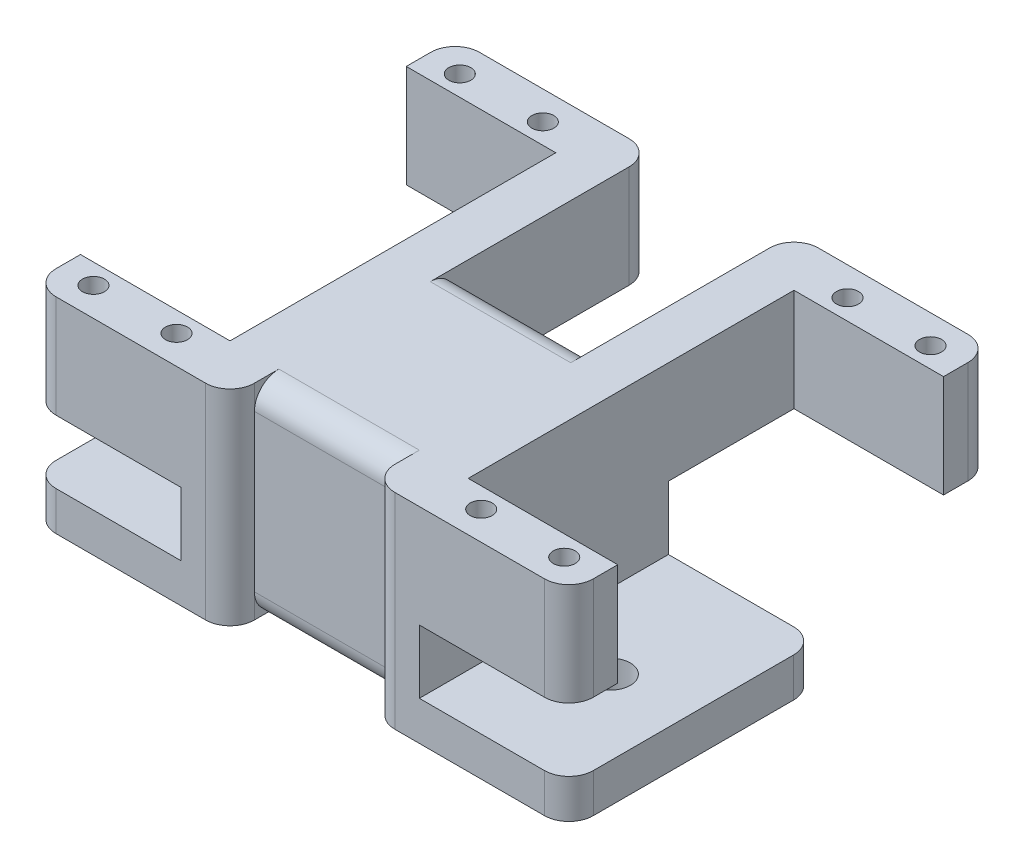
from build123d import *

# Parameters (mm, degrees)
BOSS_EXTRUDE1_DEPTH      = 8
BOSS_EXTRUDE2_DEPTH      = 13
BOSS_EXTRUDE3_DEPTH      = 21
CUT_EXTRUDE1_DEPTH       = 14.382189634
CUT_EXTRUDE2_START       = 21
CUT_EXTRUDE2_OUTLINE_R   = 2.25
CUT_EXTRUDE2_DEPTH       = 21
CUT_EXTRUDE2_2_OUTLINE_R = 4
CUT_EXTRUDE2_2_DEPTH     = 8
SKETCH6_W                = 3.704166667
SKETCH6_H                = 0.664850427
CUT_EXTRUDE3_DEPTH       = 0.5


# Read off the part's stored shape, not the designer's step: Cut-Extrude2
with BuildPart() as part:
    # Sketch1 → Boss-Extrude1 (new body)
    with BuildSketch(Plane(origin=(0, 0, 0), x_dir=(1, 0, 0), z_dir=(0, 1, 0))):
        with BuildLine():
            Line((-26.81143191, 27.740848342), (-57.429242277, 27.740848342))
            ThreePointArc((-57.429242277, 27.740848342), (-60.964776183, 26.276382248), (-62.429242277, 22.740848342))
            Line((-62.429242277, 22.740848342), (-62.429242277, -18.259151658))
            ThreePointArc((-62.429242277, -18.259151658), (-60.964776183, -21.794685564), (-57.429242277, -23.259151658))
            Line((-57.429242277, -23.259151658), (-26.81143191, -23.259151658))
            ThreePointArc((-26.81143191, -23.259151658), (-23.275898004, -21.794685564), (-21.81143191, -18.259151658))
            Line((-21.81143191, -18.259151658), (-7.429242277, -18.259151658))
            Line((-7.429242277, -18.259151658), (-7.429242277, 22.740848342))
            Line((-7.429242277, 22.740848342), (-21.81143191, 22.740848342))
            ThreePointArc((-21.81143191, 22.740848342), (-23.275898004, 26.276382248), (-26.81143191, 27.740848342))
        make_face()
    extrude(amount=BOSS_EXTRUDE1_DEPTH)

    # Sketch2 → Boss-Extrude2 (add)
    with BuildSketch(Plane(origin=(0, 8, 0), x_dir=(1, 0, 0), z_dir=(0, 1, 0))):
        with BuildLine():
            Line((-21.81143191, -18.259151658), (-7.429242277, -18.259151658))
            Line((-7.429242277, -18.259151658), (-7.429242277, 22.740848342))
            Line((-7.429242277, 22.740848342), (-21.81143191, 22.740848342))
            ThreePointArc((-21.81143191, 22.740848342), (-23.275898004, 26.276382248), (-26.81143191, 27.740848342))
            Line((-26.81143191, 27.740848342), (-31.81143191, 27.740848342))
            Line((-31.81143191, 27.740848342), (-31.81143191, -23.259151658))
            Line((-31.81143191, -23.259151658), (-26.81143191, -23.259151658))
            ThreePointArc((-26.81143191, -23.259151658), (-23.275898004, -21.794685564), (-21.81143191, -18.259151658))
        make_face()
    extrude(amount=BOSS_EXTRUDE2_DEPTH)

    # Sketch3 → Boss-Extrude3 (add)
    with BuildSketch(Plane(origin=(0, 21, 0), x_dir=(1, 0, 0), z_dir=(0, 1, 0))):
        with BuildLine():
            Line((-57.429242277, -23.259151658), (-26.81143191, -23.259151658))
            ThreePointArc((-26.81143191, -23.259151658), (-23.275898004, -21.794685564), (-21.81143191, -18.259151658))
            Line((-21.81143191, -18.259151658), (-7.429242277, -18.259151658))
            Line((-7.429242277, -18.259151658), (-7.429242277, 22.740848342))
            Line((-7.429242277, 22.740848342), (-21.81143191, 22.740848342))
            Line((-21.81143191, 22.740848342), (-21.81143191, 58.440848342))
            ThreePointArc((-21.81143191, 58.440848342), (-23.275898004, 61.976382248), (-26.81143191, 63.440848342))
            Line((-26.81143191, 63.440848342), (-57.429242277, 63.440848342))
            ThreePointArc((-57.429242277, 63.440848342), (-60.964776183, 61.976382248), (-62.429242277, 58.440848342))
            Line((-62.429242277, 58.440848342), (-62.429242277, 53.440848342))
            Line((-62.429242277, 53.440848342), (-31.81143191, 53.440848342))
            Line((-31.81143191, 53.440848342), (-31.81143191, -13.259151658))
            Line((-31.81143191, -13.259151658), (-62.429242277, -13.259151658))
            Line((-62.429242277, -13.259151658), (-62.429242277, -18.259151658))
            ThreePointArc((-62.429242277, -18.259151658), (-60.964776183, -21.794685564), (-57.429242277, -23.259151658))
        make_face()
    extrude(amount=BOSS_EXTRUDE3_DEPTH)

    # Sketch4 → Cut-Extrude1 (cut)
    with BuildSketch(Plane(origin=(-7.429242277, 0, 0), x_dir=(0, 0, -1), z_dir=(1, 0, 0))):
        with BuildLine():
            Line((-18.259151658, 42), (-18.259151658, 37))
            ThreePointArc((-18.259151658, 37), (-16.794685564, 40.535533906), (-13.259151658, 42))
            Line((-13.259151658, 42), (-18.259151658, 42))
        make_face()
        with BuildLine():
            ThreePointArc((17.740848342, 42), (21.276382248, 40.535533906), (22.740848342, 37))
            Line((22.740848342, 37), (22.740848342, 42))
            Line((22.740848342, 42), (17.740848342, 42))
        make_face()
        with BuildLine():
            ThreePointArc((22.740848342, 5), (21.276382248, 1.464466094), (17.740848342, 0))
            Line((17.740848342, 0), (22.740848342, 0))
            Line((22.740848342, 0), (22.740848342, 5))
        make_face()
        with BuildLine():
            Line((-18.259151658, 5), (-18.259151658, 0))
            Line((-18.259151658, 0), (-13.259151658, 0))
            ThreePointArc((-13.259151658, 0), (-16.794685564, 1.464466094), (-18.259151658, 5))
        make_face()
    extrude(amount=-CUT_EXTRUDE1_DEPTH, mode=Mode.SUBTRACT)

    # Cut-Extrude2 outline → Cut-Extrude2 (cut)
    with BuildSketch(Plane(origin=(0, 0, 0), x_dir=(1, 0, 0), z_dir=(0, 1, 0)).offset(CUT_EXTRUDE2_START)):
        with Locations((-38.620337094, -17.409151658)):
            Circle(CUT_EXTRUDE2_OUTLINE_R)
        with Locations((-55.620337094, -17.409151658)):
            Circle(CUT_EXTRUDE2_OUTLINE_R)
        with Locations((-55.620337094, 57.590848342)):
            Circle(CUT_EXTRUDE2_OUTLINE_R)
        with Locations((-38.620337094, 57.590848342)):
            Circle(CUT_EXTRUDE2_OUTLINE_R)
    extrude(amount=CUT_EXTRUDE2_DEPTH, mode=Mode.SUBTRACT)

    # Cut-Extrude2 2 outline → Cut-Extrude2 2 (cut)
    with BuildSketch(Plane(origin=(0, 0, 0), x_dir=(1, 0, 0), z_dir=(0, 1, 0))):
        with Locations((-47.121628292, 0.618575522)):
            Circle(CUT_EXTRUDE2_2_OUTLINE_R)
    extrude(amount=CUT_EXTRUDE2_2_DEPTH, mode=Mode.SUBTRACT)

    # Mirror1: part across plane


with BuildPart() as part_1:
    add(part.part)
    add(part.part.mirror(Plane(origin=(-7.429242277, 8, -22.740848342), x_dir=(0, 0, 1), z_dir=(-1, 0, 0))))

    # Sketch6 → Cut-Extrude3 (cut)
    # profile 1 of 7: a face of its own
    with BuildSketch(Plane.XZ):
        with BuildLine():
            add(Edge.make_bspline(
                [(-3.630096978, 6.670225042), (-3.631763453, 6.605823043), (-3.635053452, 6.47867891), (-3.662508867, 6.291704811), (-3.707167108, 6.111485598), (-3.769591277, 5.938059459), (-3.850168987, 5.77166195), (-3.949231991, 5.612719643), (-4.065238137, 5.460206444), (-4.197974341, 5.316937979), (-4.343022727, 5.185522245), (-4.497670692, 5.069977381), (-4.660192762, 4.972161462), (-4.830444829, 4.892169997), (-5.008781458, 4.830229061), (-5.195109529, 4.786992735), (-5.38908513, 4.759150358), (-5.521163241, 4.755952955), (-5.588289252, 4.75432794)],
                knots=[0, 0, 0, 0, 1.014244935, 2.002349224, 2.970143685, 3.935298574, 4.900830986, 5.877310296, 6.881148894, 7.915268703, 8.949887647, 9.960720774, 10.951801935, 11.933244874, 12.919141415, 13.920101769, 14.942934067, 16, 16, 16, 16], degree=3))
            add(Edge.make_bspline(
                [(-5.588289252, 4.75432794), (-5.654658982, 4.7560585), (-5.785442664, 4.759468624), (-5.977629635, 4.785858049), (-6.161965663, 4.829818413), (-6.33855639, 4.890732759), (-6.507440148, 4.969184205), (-6.668440563, 5.065273495), (-6.820943896, 5.179877543), (-6.964575945, 5.309220317), (-7.094912793, 5.451618473), (-7.210084839, 5.602497427), (-7.30697826, 5.761557134), (-7.387003565, 5.927673441), (-7.448871312, 6.101572669), (-7.49256508, 6.282860052), (-7.519108508, 6.471566302), (-7.522499637, 6.599894141), (-7.524220909, 6.665030898)],
                knots=[0, 0, 0, 0, 1.051446269, 2.071908608, 3.067230498, 4.050151293, 5.026863609, 6.012936299, 7.01551645, 8.045060801, 9.071444569, 10.070117656, 11.048150216, 12.017576978, 12.987003741, 13.967083865, 14.968130643, 16, 16, 16, 16], degree=3))
            add(Edge.make_bspline(
                [(-7.524220909, 6.665030898), (-7.522677039, 6.733156276), (-7.519643546, 6.86701333), (-7.490796407, 7.062913729), (-7.447342538, 7.250603238), (-7.38248997, 7.428505157), (-7.301418807, 7.598431266), (-7.20157481, 7.759133068), (-7.083122977, 7.910556556), (-6.949096905, 8.051833139), (-6.802442986, 8.179830067), (-6.647516126, 8.292812462), (-6.48549983, 8.388115618), (-6.31631827, 8.465743023), (-6.141022868, 8.526941351), (-5.958546026, 8.570109817), (-5.76932539, 8.595610461), (-5.64080295, 8.599162552), (-5.575674902, 8.600962556)],
                knots=[0, 0, 0, 0, 1.067978421, 2.098431617, 3.099715153, 4.085208694, 5.062210972, 6.048429807, 7.046490867, 8.072918869, 9.098532598, 10.095778865, 11.076610158, 12.041847152, 13.011192615, 13.984257998, 14.978533688, 16, 16, 16, 16], degree=3))
            add(Edge.make_bspline(
                [(-5.575674902, 8.600962556), (-5.531861998, 8.60038998), (-5.444790961, 8.59925208), (-5.315723745, 8.585839596), (-5.189356405, 8.565959759), (-5.065471747, 8.538699532), (-4.94453503, 8.502205266), (-4.826289341, 8.457263093), (-4.710275413, 8.405563165), (-4.597612896, 8.345314546), (-4.489388608, 8.278282732), (-4.386098291, 8.205156585), (-4.288999314, 8.125736085), (-4.197434557, 8.040293142), (-4.112073408, 7.948484926), (-4.031324609, 7.851542079), (-3.958443559, 7.747041593), (-3.890036561, 7.63838198), (-3.828738832, 7.525751857), (-3.775917934, 7.409796723), (-3.730364535, 7.292295021), (-3.694203068, 7.171835407), (-3.664789233, 7.049817615), (-3.645328296, 6.924965156), (-3.631804835, 6.798398769), (-3.630667614, 6.713051012), (-3.630096978, 6.670225042)],
                knots=[0, 0, 0, 0, 1.034751683, 2.056401036, 3.062285641, 4.056148242, 5.050783641, 6.043890034, 7.043081327, 8.049576835, 9.059882113, 10.048974407, 11.037410495, 12.021414423, 13.005418351, 13.997561464, 14.999568372, 16.012961702, 17.030138968, 18.026421002, 19.021605583, 20.005054086, 20.995836695, 21.984410968, 22.988613675, 24, 24, 24, 24], degree=3))
        make_face()
        with BuildLine():
            add(Edge.make_bspline(
                [(-4.294947405, 6.68061333), (-4.296110375, 6.723955514), (-4.298405611, 6.80949564), (-4.315892167, 6.934967463), (-4.343820294, 7.055424706), (-4.384273456, 7.170200275), (-4.435761452, 7.279789224), (-4.498098145, 7.384394768), (-4.57345012, 7.482534417), (-4.657681864, 7.575647604), (-4.751923083, 7.659476384), (-4.851818246, 7.734849813), (-4.959770999, 7.795792289), (-5.07222567, 7.848194119), (-5.192026118, 7.886900975), (-5.317227992, 7.916372209), (-5.449116578, 7.932424191), (-5.538781653, 7.934865302), (-5.584579149, 7.936112128)],
                knots=[0, 0, 0, 0, 1.033668485, 2.040047952, 3.016132939, 3.979056467, 4.937231767, 5.900589077, 6.877725736, 7.88429546, 8.891280164, 9.882584218, 10.863295226, 11.842887319, 12.837417301, 13.860812229, 14.907384602, 16, 16, 16, 16], degree=3))
            add(Edge.make_bspline(
                [(-5.584579149, 7.936112128), (-5.63534866, 7.93459998), (-5.734848489, 7.931636421), (-5.880049433, 7.910992961), (-6.016888699, 7.875138308), (-6.145838484, 7.825252393), (-6.266239925, 7.760365487), (-6.378742371, 7.681699724), (-6.482797115, 7.588557133), (-6.543583072, 7.516887136), (-6.574434584, 7.4805115)],
                knots=[0, 0, 0, 0, 1.078379799, 2.113445728, 3.107478808, 4.077334175, 5.043482131, 6.005506737, 6.987708079, 8, 8, 8, 8], degree=3))
            add(Edge.make_bspline(
                [(-6.574434584, 7.4805115), (-6.597224035, 7.450707481), (-6.642289487, 7.391770931), (-6.700050108, 7.297695366), (-6.749556723, 7.200816058), (-6.789557481, 7.100401932), (-6.821021406, 6.996665056), (-6.843055075, 6.889619658), (-6.856883107, 6.77941741), (-6.858535819, 6.704893485), (-6.859370482, 6.66725696)],
                knots=[0, 0, 0, 0, 1.023928204, 2.024787132, 3.009472467, 3.9914905, 4.972207045, 5.96565515, 6.972602802, 8, 8, 8, 8], degree=3))
            add(Edge.make_bspline(
                [(-6.859370482, 6.66725696), (-6.858197713, 6.624659999), (-6.855890255, 6.540849137), (-6.838618085, 6.417713722), (-6.809391968, 6.299743229), (-6.769281691, 6.186219614), (-6.717192193, 6.0774169), (-6.652647215, 5.973900796), (-6.577519211, 5.874914062), (-6.491835149, 5.781963722), (-6.397549237, 5.697076235), (-6.296612686, 5.622798737), (-6.190303581, 5.559704087), (-6.078545662, 5.508551806), (-5.961375908, 5.467897431), (-5.838628882, 5.440312545), (-5.710745959, 5.422535366), (-5.623719543, 5.42031136), (-5.579385005, 5.419178367)],
                knots=[0, 0, 0, 0, 1.026250569, 2.01918027, 2.989144455, 3.950556051, 4.91558185, 5.889785058, 6.885144561, 7.905911388, 8.931486752, 9.937601838, 10.920932928, 11.905004308, 12.894547393, 13.903711934, 14.932071819, 16, 16, 16, 16], degree=3))
            add(Edge.make_bspline(
                [(-5.579385005, 5.419178367), (-5.535305195, 5.420350198), (-5.448540813, 5.422656767), (-5.320989639, 5.439958473), (-5.198773625, 5.469002396), (-5.081693179, 5.509221377), (-4.969633519, 5.560578885), (-4.862988713, 5.624087654), (-4.76186186, 5.699524839), (-4.666942101, 5.785154259), (-4.579716923, 5.878356619), (-4.504021324, 5.978418665), (-4.438244255, 6.082540549), (-4.386717156, 6.193111335), (-4.345665625, 6.307868837), (-4.315434688, 6.427513312), (-4.298528451, 6.552497919), (-4.296151727, 6.637527532), (-4.294947405, 6.68061333)],
                knots=[0, 0, 0, 0, 1.055025985, 2.07665775, 3.074803781, 4.057872707, 5.035505728, 6.020516407, 7.023567878, 8.050795229, 9.077271434, 10.074415901, 11.050397877, 12.019801805, 12.988065821, 13.964604439, 14.968634123, 16, 16, 16, 16], degree=3))
        make_face(mode=Mode.SUBTRACT)
    # profile 2 of 7: a face of its own
    with BuildSketch(Plane.XZ):
        with BuildLine():
            Line((-3.72507561, 3.776048026), (-3.72507561, 3.111197598))
            Line((-3.72507561, 3.111197598), (-6.135158409, 3.111197598))
            add(Edge.make_bspline(
                [(-6.135158409, 3.111197598), (-6.160145102, 3.111161447), (-6.208406642, 3.111091621), (-6.27764615, 3.107596103), (-6.341291756, 3.104397463), (-6.39927378, 3.098626209), (-6.451617025, 3.090100089), (-6.498657727, 3.081844022), (-6.539553673, 3.070670252), (-6.586103967, 3.053877862), (-6.638405764, 3.028006301), (-6.692915898, 2.985733607), (-6.742664307, 2.936954534), (-6.784072997, 2.878490006), (-6.817568895, 2.812781046), (-6.842385649, 2.740188697), (-6.856180469, 2.660815288), (-6.858286501, 2.605932929), (-6.859370482, 2.577684811)],
                knots=[0, 0, 0, 0, 1.155499968, 2.231836252, 3.205919964, 4.102923608, 4.924856345, 5.658536265, 6.31071849, 6.882491295, 7.94666036, 8.992281882, 10.060072772, 11.158554251, 12.289267114, 13.461410017, 14.693379945, 16, 16, 16, 16], degree=3))
            add(Edge.make_bspline(
                [(-6.859370482, 2.577684811), (-6.858504207, 2.547671125), (-6.856815117, 2.489149517), (-6.839877452, 2.40480448), (-6.813535498, 2.32644082), (-6.775171764, 2.256199586), (-6.729884701, 2.193827334), (-6.677006505, 2.142080463), (-6.619239612, 2.099463053), (-6.564850967, 2.072673968), (-6.515267107, 2.057133466), (-6.470582546, 2.046961946), (-6.418301696, 2.038208968), (-6.35865613, 2.030755689), (-6.291259293, 2.026156524), (-6.216597456, 2.021227444), (-6.134177344, 2.019412162), (-6.076785853, 2.019104014), (-6.046857962, 2.018943325)],
                knots=[0, 0, 0, 0, 1.260838023, 2.458420682, 3.603291091, 4.724957099, 5.81103668, 6.833527554, 7.823976978, 8.819602765, 9.36572267, 10.006654001, 10.745469399, 11.594489782, 12.533565386, 13.586096035, 14.741223574, 16, 16, 16, 16], degree=3))
            Line((-6.046857962, 2.018943325), (-3.72507561, 2.018943325))
            Line((-3.72507561, 2.018943325), (-3.72507561, 1.354092897))
            Line((-3.72507561, 1.354092897), (-5.934812856, 1.354092897))
            add(Edge.make_bspline(
                [(-5.934812856, 1.354092897), (-5.979582855, 1.354173274), (-6.065671195, 1.354327832), (-6.189373009, 1.357211712), (-6.302416051, 1.362494651), (-6.404595423, 1.369052451), (-6.496203021, 1.376916569), (-6.577192108, 1.387094108), (-6.64751927, 1.399544112), (-6.727568802, 1.418203234), (-6.819745631, 1.450360385), (-6.925882315, 1.502219), (-7.029796067, 1.568046072), (-7.130347379, 1.645849891), (-7.223744262, 1.733703617), (-7.305777951, 1.829630844), (-7.374890647, 1.932028417), (-7.430324249, 2.04173065), (-7.473159694, 2.159520899), (-7.501805084, 2.28622675), (-7.521401665, 2.421501357), (-7.523262324, 2.514785657), (-7.524220909, 2.5628444)],
                knots=[0, 0, 0, 0, 1.170789758, 2.251314523, 3.23554622, 4.130075238, 4.928857907, 5.639700176, 6.263954887, 6.795817153, 7.787924184, 8.809125334, 9.87873356, 10.999178519, 12.129364722, 13.22595565, 14.293390689, 15.352147651, 16.432536881, 17.562186165, 18.74407303, 20, 20, 20, 20], degree=3))
            add(Edge.make_bspline(
                [(-7.524220909, 2.5628444), (-7.523683025, 2.594774829), (-7.522621789, 2.657772909), (-7.513266315, 2.750423141), (-7.499475589, 2.839985869), (-7.479371803, 2.926301755), (-7.453346947, 3.009637755), (-7.42159182, 3.089884881), (-7.383360643, 3.16652845), (-7.34036968, 3.239837576), (-7.293246127, 3.309439433), (-7.24187622, 3.373704706), (-7.188462267, 3.433533538), (-7.131899959, 3.487849744), (-7.072400641, 3.537003931), (-7.00989563, 3.58094729), (-6.944373128, 3.619600784), (-6.874656702, 3.653940375), (-6.797201672, 3.683331526), (-6.709253279, 3.708109425), (-6.609432916, 3.729755963), (-6.497515725, 3.745842398), (-6.373870563, 3.760426452), (-6.238175318, 3.769657355), (-6.090426096, 3.774486456), (-5.987994624, 3.77551435), (-5.934812856, 3.776048026)],
                knots=[0, 0, 0, 0, 1.001195678, 1.975338534, 2.91783225, 3.841754112, 4.752027347, 5.653798756, 6.545402703, 7.435486725, 8.317659034, 9.179053568, 10.013983148, 10.831468265, 11.636005169, 12.432309474, 13.225243684, 14.019732185, 14.86686161, 15.819485008, 16.883051984, 18.067941734, 19.364090787, 20.787286826, 22.331979793, 24, 24, 24, 24], degree=3))
            Line((-5.934812856, 3.776048026), (-3.72507561, 3.776048026))
        make_face()
    # profile 3 of 7: a face of its own
    with BuildSketch(Plane.XZ):
        Polygon((-3.72507561, 0.565770248), (-3.72507561, -1.428781034), (-4.389926037, -1.428781034), (-4.389926037, -0.763930607), (-7.429242277, -0.763930607), (-7.429242277, -0.09908018), (-4.389926037, -0.09908018), (-4.389926037, 0.565770248), align=None)
    # profile 4 of 7: a face of its own
    with BuildSketch(Plane.XZ):
        with BuildLine():
            Line((-4.220003328, -4.16416565), (-4.674861935, -3.66701187))
            add(Edge.make_bspline(
                [(-4.674861935, -3.66701187), (-4.644816436, -3.645720032), (-4.587133269, -3.604842672), (-4.509978467, -3.538518132), (-4.443727897, -3.472589835), (-4.390275739, -3.405709809), (-4.347245068, -3.339029517), (-4.317565079, -3.271132302), (-4.2984777, -3.202799274), (-4.296112434, -3.156865917), (-4.294947405, -3.134241104)],
                knots=[0, 0, 0, 0, 1.299459705, 2.494781419, 3.587730629, 4.594196874, 5.512431013, 6.380462003, 7.202284646, 8, 8, 8, 8], degree=3))
            add(Edge.make_bspline(
                [(-4.294947405, -3.134241104), (-4.295687451, -3.113139098), (-4.297116285, -3.07239667), (-4.311318789, -3.014315317), (-4.335830225, -2.962749864), (-4.367880991, -2.917750637), (-4.406494732, -2.882104611), (-4.446990618, -2.853644023), (-4.491688918, -2.83761832), (-4.522389514, -2.835509022), (-4.53758813, -2.834464795)],
                knots=[0, 0, 0, 0, 1.185010067, 2.2879431, 3.333075148, 4.379039566, 5.372662701, 6.27520591, 7.14612461, 8, 8, 8, 8], degree=3))
            add(Edge.make_bspline(
                [(-4.53758813, -2.834464795), (-4.553005917, -2.835119159), (-4.584055197, -2.836436958), (-4.629561784, -2.849165104), (-4.674027017, -2.868350053), (-4.701095119, -2.886682055), (-4.714931045, -2.896052502)],
                knots=[0, 0, 0, 0, 0.967525499, 1.948461899, 2.951351359, 4, 4, 4, 4], degree=3))
            add(Edge.make_bspline(
                [(-4.714931045, -2.896052502), (-4.725684272, -2.904572498), (-4.750436779, -2.924184403), (-4.789675776, -2.961545783), (-4.837422595, -3.008530418), (-4.8934157, -3.066103258), (-4.956925582, -3.13419367), (-5.028323731, -3.213404272), (-5.10805829, -3.302615947), (-5.163657699, -3.365953171), (-5.19279229, -3.399142446)],
                knots=[0, 0, 0, 0, 0.473868417, 1.090782513, 1.870421581, 2.78911798, 3.865477667, 5.087766164, 6.473963263, 8, 8, 8, 8], degree=3))
            add(Edge.make_bspline(
                [(-5.19279229, -3.399142446), (-5.219758902, -3.430301526), (-5.27093593, -3.489434986), (-5.343573503, -3.573570158), (-5.408923756, -3.647510961), (-5.466005923, -3.712334544), (-5.515418925, -3.767058246), (-5.557398955, -3.811912125), (-5.591128741, -3.847443994), (-5.611501552, -3.867641781), (-5.620196136, -3.87626167)],
                knots=[0, 0, 0, 0, 1.543621617, 2.929473131, 4.163658386, 5.240097082, 6.164993805, 6.925417477, 7.541396219, 8, 8, 8, 8], degree=3))
            add(Edge.make_bspline(
                [(-5.620196136, -3.87626167), (-5.655574073, -3.908982375), (-5.723582893, -3.971883061), (-5.829287059, -4.05342169), (-5.931768395, -4.121551343), (-6.034175763, -4.173706051), (-6.137739226, -4.211882432), (-6.244242051, -4.239843682), (-6.355512244, -4.256354923), (-6.431417467, -4.258207343), (-6.469809685, -4.259144282)],
                knots=[0, 0, 0, 0, 1.20648512, 2.3192881, 3.339983362, 4.284774958, 5.190427137, 6.099526693, 7.038756749, 8, 8, 8, 8], degree=3))
            add(Edge.make_bspline(
                [(-6.469809685, -4.259144282), (-6.507219805, -4.258480779), (-6.580619853, -4.257178961), (-6.688034872, -4.241251448), (-6.790816652, -4.218507292), (-6.887935471, -4.183461207), (-6.980542477, -4.140386879), (-7.068668025, -4.087889399), (-7.150257696, -4.023706976), (-7.227501614, -3.952415303), (-7.296869313, -3.872340678), (-7.357902969, -3.786183009), (-7.409840725, -3.694103179), (-7.450975076, -3.595757653), (-7.484006278, -3.491748432), (-7.50747792, -3.381944029), (-7.521982096, -3.266216029), (-7.523463886, -3.187215567), (-7.524220909, -3.146855453)],
                knots=[0, 0, 0, 0, 1.043082113, 2.046565928, 3.024368146, 3.976196322, 4.921091788, 5.871642728, 6.831173094, 7.81279273, 8.801063391, 9.781590382, 10.755046466, 11.74476232, 12.751114423, 13.796272686, 14.874149815, 16, 16, 16, 16], degree=3))
            add(Edge.make_bspline(
                [(-7.524220909, -3.146855453), (-7.523659063, -3.115174955), (-7.522546285, -3.052429399), (-7.513455694, -2.959953252), (-7.498798556, -2.870652038), (-7.477741228, -2.784649771), (-7.451302735, -2.701691646), (-7.418401618, -2.621854771), (-7.379676615, -2.545223684), (-7.335105701, -2.471304956), (-7.283382248, -2.400608087), (-7.225581759, -2.332182616), (-7.160451292, -2.266883217), (-7.08926107, -2.203370598), (-7.010186662, -2.143890459), (-6.925509093, -2.085393026), (-6.833232217, -2.030709873), (-6.768511138, -1.996917498), (-6.735453047, -1.979657103)],
                knots=[0, 0, 0, 0, 1.016957334, 2.014158747, 2.980235577, 3.920141478, 4.854360818, 5.773095257, 6.689355356, 7.608638744, 8.541033765, 9.498850575, 10.481527934, 11.499755671, 12.559141621, 13.65604909, 14.802761907, 16, 16, 16, 16], degree=3))
            Line((-6.735453047, -1.979657103), (-6.38447732, -2.564369309))
            add(Edge.make_bspline(
                [(-6.38447732, -2.564369309), (-6.422003717, -2.58595805), (-6.49394503, -2.627345512), (-6.5906073, -2.697480436), (-6.673382535, -2.769330085), (-6.740807675, -2.844555558), (-6.793784282, -2.922242143), (-6.831645041, -3.002765082), (-6.855080808, -3.086180951), (-6.857942856, -3.143000052), (-6.859370482, -3.171342132)],
                knots=[0, 0, 0, 0, 1.283663364, 2.460892379, 3.537111102, 4.529833553, 5.449777664, 6.316464042, 7.160231139, 8, 8, 8, 8], degree=3))
            add(Edge.make_bspline(
                [(-6.859370482, -3.171342132), (-6.858215684, -3.200175394), (-6.855975208, -3.256116122), (-6.834872195, -3.336095802), (-6.802481853, -3.409745572), (-6.755375082, -3.473065671), (-6.701659661, -3.526836608), (-6.641077125, -3.565384843), (-6.576315143, -3.590389736), (-6.531123541, -3.592987386), (-6.508394754, -3.594293855)],
                knots=[0, 0, 0, 0, 1.13537643, 2.202795631, 3.242191317, 4.290390765, 5.297919085, 6.223733717, 7.106639842, 8, 8, 8, 8], degree=3))
            add(Edge.make_bspline(
                [(-6.508394754, -3.594293855), (-6.48725993, -3.593070963), (-6.444326557, -3.590586774), (-6.380454476, -3.572388591), (-6.316892109, -3.54370055), (-6.26420475, -3.510777653), (-6.220287646, -3.47645376), (-6.18280763, -3.44280977), (-6.140532396, -3.402935823), (-6.094614743, -3.355815907), (-6.044171821, -3.302366499), (-5.989323562, -3.242412616), (-5.93051706, -3.175308611), (-5.890460288, -3.127877461), (-5.869515047, -3.10307624)],
                knots=[0, 0, 0, 0, 0.916057066, 1.860882232, 2.859899639, 3.934694552, 4.546382938, 5.276161949, 6.118633209, 7.067046139, 8.129668089, 9.306861125, 10.591787583, 12, 12, 12, 12], degree=3))
            add(Edge.make_bspline(
                [(-5.869515047, -3.10307624), (-5.829622072, -3.055929936), (-5.75305538, -2.965441908), (-5.639991624, -2.837547383), (-5.534242916, -2.722385405), (-5.434970081, -2.620714404), (-5.342785572, -2.532263252), (-5.258567559, -2.455960628), (-5.180607481, -2.393468016), (-5.088113187, -2.327772648), (-4.975994752, -2.264350088), (-4.840384565, -2.210555936), (-4.70508066, -2.175459547), (-4.614217297, -2.171542372), (-4.569495015, -2.169614368)],
                knots=[0, 0, 0, 0, 1.34561873, 2.582649632, 3.719171478, 4.751946187, 5.678152813, 6.502542634, 7.227205346, 7.853698961, 8.973370308, 10.023159194, 11.027013428, 12, 12, 12, 12], degree=3))
            add(Edge.make_bspline(
                [(-4.569495015, -2.169614368), (-4.537782536, -2.170419144), (-4.475305548, -2.17200464), (-4.383431714, -2.186106127), (-4.294822121, -2.207278189), (-4.209503743, -2.237707986), (-4.128420762, -2.278507135), (-4.050325428, -2.326755606), (-3.975353821, -2.383449313), (-3.905950462, -2.449252944), (-3.84147828, -2.520637844), (-3.78488623, -2.597094605), (-3.737291091, -2.677824895), (-3.697229331, -2.762257653), (-3.667079383, -2.851477905), (-3.645516917, -2.944674812), (-3.632725881, -3.041875226), (-3.630984196, -3.107984882), (-3.630096978, -3.141661309)],
                knots=[0, 0, 0, 0, 1.010961173, 1.991702108, 2.958025473, 3.913824419, 4.873522744, 5.847800578, 6.838738273, 7.865764422, 8.893759806, 9.903642949, 10.894078012, 11.878777586, 12.879248405, 13.891624672, 14.925988217, 16, 16, 16, 16], degree=3))
            add(Edge.make_bspline(
                [(-3.630096978, -3.141661309), (-3.631697856, -3.185302567), (-3.634886977, -3.272240593), (-3.659693589, -3.400819631), (-3.699119382, -3.52646962), (-3.745551221, -3.62804222), (-3.791986688, -3.708147722), (-3.833803752, -3.769747094), (-3.882008087, -3.832549986), (-3.936791816, -3.896880059), (-3.997789063, -3.962410392), (-4.06624022, -4.028589594), (-4.139914047, -4.097029799), (-4.192839221, -4.141394994), (-4.220003328, -4.16416565)],
                knots=[0, 0, 0, 0, 1.282867522, 2.555608537, 3.83715526, 5.14906667, 5.830341525, 6.558732832, 7.337173124, 8.157810814, 9.043130442, 9.96912168, 10.957641678, 12, 12, 12, 12], degree=3))
        make_face()
    # profile 5 of 7: a face of its own
    with BuildSketch(Plane.XZ):
        with Locations((-5.577158944, -5.474870777)):
            Rectangle(SKETCH6_W, SKETCH6_H)
    # profile 6 of 7: a face of its own
    with BuildSketch(Plane.XZ):
        with BuildLine():
            Line((-3.72507561, -6.975533171), (-3.72507561, -7.81327439))
            add(Edge.make_bspline(
                [(-3.72507561, -7.81327439), (-3.725532185, -7.878585944), (-3.726414749, -8.004833915), (-3.736358259, -8.187742416), (-3.75165231, -8.357823446), (-3.772686707, -8.51518931), (-3.800538559, -8.659508482), (-3.835415879, -8.790624375), (-3.875934735, -8.909093322), (-3.923022522, -9.016306929), (-3.978275221, -9.113910775), (-4.04034211, -9.205932799), (-4.110162692, -9.293433819), (-4.187897274, -9.376899155), (-4.273029607, -9.456532104), (-4.367273736, -9.530463379), (-4.468188657, -9.601063154), (-4.576124609, -9.667185944), (-4.690868501, -9.726043485), (-4.810614348, -9.778433296), (-4.935439976, -9.82208347), (-5.065173032, -9.857624992), (-5.199437711, -9.885935778), (-5.338489838, -9.905749274), (-5.482204849, -9.917996909), (-5.579607411, -9.919239422), (-5.629100383, -9.919870778)],
                knots=[0, 0, 0, 0, 1.443473934, 2.790251435, 4.047465151, 5.217279069, 6.298047006, 7.293970747, 8.213772908, 9.063072335, 9.878180301, 10.689410498, 11.514196541, 12.349783386, 13.208549609, 14.087984609, 14.994942826, 15.929749014, 16.883358292, 17.843153412, 18.816615524, 19.8034191, 20.814532747, 21.847477555, 22.906243002, 24, 24, 24, 24], degree=3))
            add(Edge.make_bspline(
                [(-5.629100383, -9.919870778), (-5.69893828, -9.918217715), (-5.836418268, -9.914963564), (-6.038167321, -9.887549451), (-6.231568692, -9.843218777), (-6.415087193, -9.78086059), (-6.587168873, -9.703640714), (-6.744366629, -9.611160378), (-6.88700092, -9.506076138), (-7.012705041, -9.387455484), (-7.121411242, -9.259221093), (-7.213424606, -9.125437621), (-7.287285741, -8.986225253), (-7.333399017, -8.863300121), (-7.362407772, -8.756411389), (-7.379169984, -8.662693281), (-7.395136796, -8.55610515), (-7.406995879, -8.435961536), (-7.417865466, -8.302418241), (-7.423698744, -8.155382869), (-7.428570705, -7.995102028), (-7.429012554, -7.883771114), (-7.429242277, -7.82588874)],
                knots=[0, 0, 0, 0, 1.315357893, 2.589359008, 3.828307697, 5.048525571, 6.235260212, 7.375784434, 8.478395391, 9.566323578, 10.624275077, 11.640246088, 12.619991216, 13.585951757, 14.107079058, 14.704817694, 15.378369799, 16.137463096, 16.978827496, 17.902494345, 18.909479843, 20, 20, 20, 20], degree=3))
            Line((-7.429242277, -7.82588874), (-7.429242277, -6.975533171))
            Line((-7.429242277, -6.975533171), (-3.72507561, -6.975533171))
        make_face()
        with BuildLine():
            Line((-4.389926037, -7.640383598), (-6.764391849, -7.640383598))
            Line((-6.764391849, -7.640383598), (-6.764391849, -7.987649223))
            add(Edge.make_bspline(
                [(-6.764391849, -7.987649223), (-6.764316135, -8.0289685), (-6.764170512, -8.108439223), (-6.75723435, -8.223176958), (-6.750272356, -8.329280271), (-6.737058259, -8.426457084), (-6.722338685, -8.515414618), (-6.701854382, -8.594930831), (-6.680337357, -8.666644898), (-6.652943517, -8.729680844), (-6.622109927, -8.787416636), (-6.585984801, -8.840873381), (-6.545869214, -8.892474117), (-6.500583297, -8.941254079), (-6.450726765, -8.987398067), (-6.396042561, -9.030632374), (-6.336698182, -9.071536773), (-6.272377291, -9.109050738), (-6.203769109, -9.143363557), (-6.131499475, -9.173678041), (-6.055174412, -9.199269016), (-5.974827705, -9.218702869), (-5.890957938, -9.23525795), (-5.803025857, -9.247211989), (-5.71131874, -9.25372459), (-5.648897419, -9.254584219), (-5.617228054, -9.25502035)],
                knots=[0, 0, 0, 0, 1.502785267, 2.890356349, 4.180881464, 5.369512404, 6.456827674, 7.458527365, 8.354953631, 9.177280646, 9.954299195, 10.732931168, 11.52132839, 12.330004022, 13.151395147, 13.990341431, 14.86389591, 15.771318928, 16.696852441, 17.652725226, 18.620174565, 19.621874256, 20.657747019, 21.729235313, 22.847930884, 24, 24, 24, 24], degree=3))
            add(Edge.make_bspline(
                [(-5.617228054, -9.25502035), (-5.568700468, -9.254134388), (-5.474075437, -9.25240683), (-5.336252012, -9.235746632), (-5.206470612, -9.208627008), (-5.085212888, -9.169929918), (-4.972138043, -9.121151037), (-4.868204061, -9.060092896), (-4.771664994, -8.989383203), (-4.71503208, -8.933467907), (-4.686734264, -8.905528664)],
                knots=[0, 0, 0, 0, 1.13821349, 2.219428113, 3.251817212, 4.244760574, 5.201143372, 6.134805572, 7.068016741, 8, 8, 8, 8], degree=3))
            add(Edge.make_bspline(
                [(-4.686734264, -8.905528664), (-4.6626207, -8.877977925), (-4.613371475, -8.821708661), (-4.554358308, -8.722918323), (-4.502509458, -8.614056488), (-4.461399101, -8.492632722), (-4.428887279, -8.359820533), (-4.40646467, -8.214828888), (-4.392056139, -8.05843425), (-4.390651283, -7.950087688), (-4.389926037, -7.894154632)],
                knots=[0, 0, 0, 0, 0.813307809, 1.661089106, 2.549956539, 3.493439533, 4.508053171, 5.589449661, 6.755572447, 8, 8, 8, 8], degree=3))
            Line((-4.389926037, -7.894154632), (-4.389926037, -7.640383598))
        make_face(mode=Mode.SUBTRACT)
    # profile 7 of 7: a face of its own
    with BuildSketch(Plane.XZ):
        Polygon((-3.72507561, -10.898150692), (-3.72507561, -12.892701974), (-4.389926037, -12.892701974), (-4.389926037, -11.56300112), (-5.102265781, -11.56300112), (-5.102265781, -12.892701974), (-5.767116208, -12.892701974), (-5.767116208, -11.56300112), (-6.764391849, -11.56300112), (-6.764391849, -12.892701974), (-7.429242277, -12.892701974), (-7.429242277, -10.898150692), align=None)
    extrude(amount=-CUT_EXTRUDE3_DEPTH, mode=Mode.SUBTRACT)


solid = part_1.part
